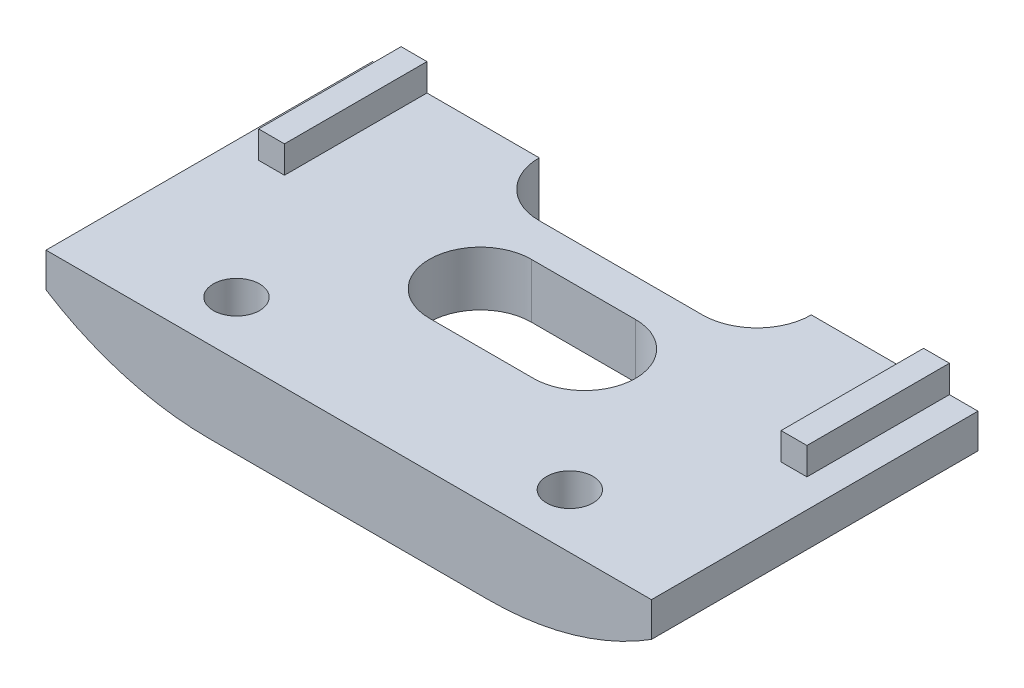
from build123d import *

# Parameters (mm, degrees)
EXTRUDE_1_DEPTH             = 24
SKETCH_2_W                  = 20
SKETCH_2_H                  = 4
CUT_EXTRUDE_1_DEPTH         = 4
SKETCH_3_W                  = 1.9
SKETCH_3_H                  = 10.472908188
EXTRUDE_2_DEPTH             = 2
FILLET_1_R                  = 4
CUT_EXTRUDE_2_DEPTH         = 34.690688625
SWEEP_START                 = -3.83
SWEEP_4_3_DEPTH             = 7.66
HOLE_WIZARD_M31_D           = 3.4
HOLE_WIZARD_M31_CBORE_D     = 6.5
HOLE_WIZARD_M31_CBORE_DEPTH = 3


with BuildPart() as part:
    # Эскиз1 → Бобышка-Вытянуть1 (new body)
    with BuildSketch(Plane.XY):
        with BuildLine():
            Line((-20.25, 2.586649223), (20.25, 2.586649223))
            Line((20.25, 2.586649223), (22.25, 2.586649223))
            Line((22.25, 2.586649223), (22.25, 0.053782912))
            ThreePointArc((22.25, 0.053782912), (16.495418641, -2.529195567), (10.25, -3.413350777))
            Line((10.25, -3.413350777), (-10.25, -3.413350777))
            ThreePointArc((-10.25, -3.413350777), (-16.495418641, -2.529195567), (-22.25, 0.053782912))
            Line((-22.25, 0.053782912), (-22.25, 2.586649223))
            Line((-22.25, 2.586649223), (-20.25, 2.586649223))
        make_face()
    extrude(amount=EXTRUDE_1_DEPTH)

    # Эскиз2 → Вырез-Вытянуть1 (cut)
    with BuildSketch(Plane(origin=(0, 2.586649223, 0), x_dir=(1, 0, 0), z_dir=(0, 1, 0))):
        with Locations((0, -2)):
            Rectangle(SKETCH_2_W, SKETCH_2_H)
    extrude(amount=-CUT_EXTRUDE_1_DEPTH, mode=Mode.SUBTRACT)

    # Эскиз3 → Бобышка-Вытянуть2 (add)
    with BuildSketch(Plane(origin=(0, 2.586649223, 0), x_dir=(1, 0, 0), z_dir=(0, 1, 0))):
        with Locations((19.2, -5.236454094)):
            Rectangle(SKETCH_3_W, SKETCH_3_H)
        with Locations((-19.2, -5.236454094)):
            Rectangle(SKETCH_3_W, SKETCH_3_H)
    extrude(amount=EXTRUDE_2_DEPTH)

    # Скругление1
    fillet_1_edges = [part.edges().sort_by_distance(p)[0] for p in [
        (-10, 0.586649223, 4),
        (10, 0.586649223, 4),
    ]]
    fillet(fillet_1_edges, radius=FILLET_1_R - 0.0001)  # a hair under: the kernel refuses the full size

    # Эскиз4 → Вырез-Вытянуть2 (cut, through all)
    with BuildSketch(Plane.XZ.offset(3.413350777)):
        with BuildLine():
            Line((-3.83, 14.25), (3.83, 14.25))
            ThreePointArc((3.83, 14.25), (7.58, 10.5), (3.83, 6.75))
            Line((3.83, 6.75), (-3.83, 6.75))
            ThreePointArc((-3.83, 6.75), (-7.58, 10.5), (-3.83, 14.25))
        make_face()
    extrude(amount=-CUT_EXTRUDE_2_DEPTH, mode=Mode.SUBTRACT)

    # Вырез-По траектории4: read off the stored shape, not the designer's step
    # Вырез-По траектории4 outline → Вырез-По траектории4 (revolve, cut)
    with BuildSketch(Plane(origin=(3.83, 0, 10.5), x_dir=(1, 0, 0), z_dir=(0, 0, 1))):
        with BuildLine():
            Line((3.75, -3.413351016), (7.214101753, -3.413351016))
            ThreePointArc((7.214101753, -3.413351016), (5.750000119, -1.949249231), (3.75, -1.413350777))
            Line((3.75, -1.413350777), (3.75, -3.413351016))
        make_face()
    revolve(axis=Axis((3.83, 0, 10.5), (0, 1, 0)), mode=Mode.SUBTRACT)

    # Sweep 4 2 outline → Sweep 4 2 (revolve, cut)
    with BuildSketch(Plane(origin=(-3.83, 0, 10.5), x_dir=(1, 0, 0), z_dir=(0, 0, 1))):
        with BuildLine():
            Line((3.75, -3.413350777), (7.214101615, -3.413350777))
            ThreePointArc((7.214101615, -3.413350777), (5.75, -1.949249162), (3.75, -1.413350777))
            Line((3.75, -1.413350777), (3.75, -3.413350777))
        make_face()
    revolve(axis=Axis((-3.83, 0, 10.5), (0, 1, 0)), mode=Mode.SUBTRACT)

    # Sweep 4 3 outline → Sweep 4 3 (cut)
    with BuildSketch(Plane.YZ.offset(SWEEP_START)):
        with BuildLine():
            ThreePointArc((-1.413350777, 14.25), (-1.949249162, 16.25), (-3.413350777, 17.714101615))
            Line((-3.413350777, 17.714101615), (-3.413350777, 3.285898385))
            ThreePointArc((-3.413350777, 3.285898385), (-1.949249162, 4.75), (-1.413350777, 6.75))
            Line((-1.413350777, 6.75), (-1.413350777, 14.25))
        make_face()
    extrude(amount=SWEEP_4_3_DEPTH, mode=Mode.SUBTRACT)

    # Цековка для винта с внутренним шестигранником M31 (through all)
    with Locations(Plane(origin=(-12.25, -3.413350777, 20), x_dir=(-1, 0, 0), z_dir=(0, -1, 0))):
        with Locations((0, 0), (-24.5, 0)):
            CounterBoreHole(HOLE_WIZARD_M31_D / 2, HOLE_WIZARD_M31_CBORE_D / 2, HOLE_WIZARD_M31_CBORE_DEPTH)


solid = part.part
